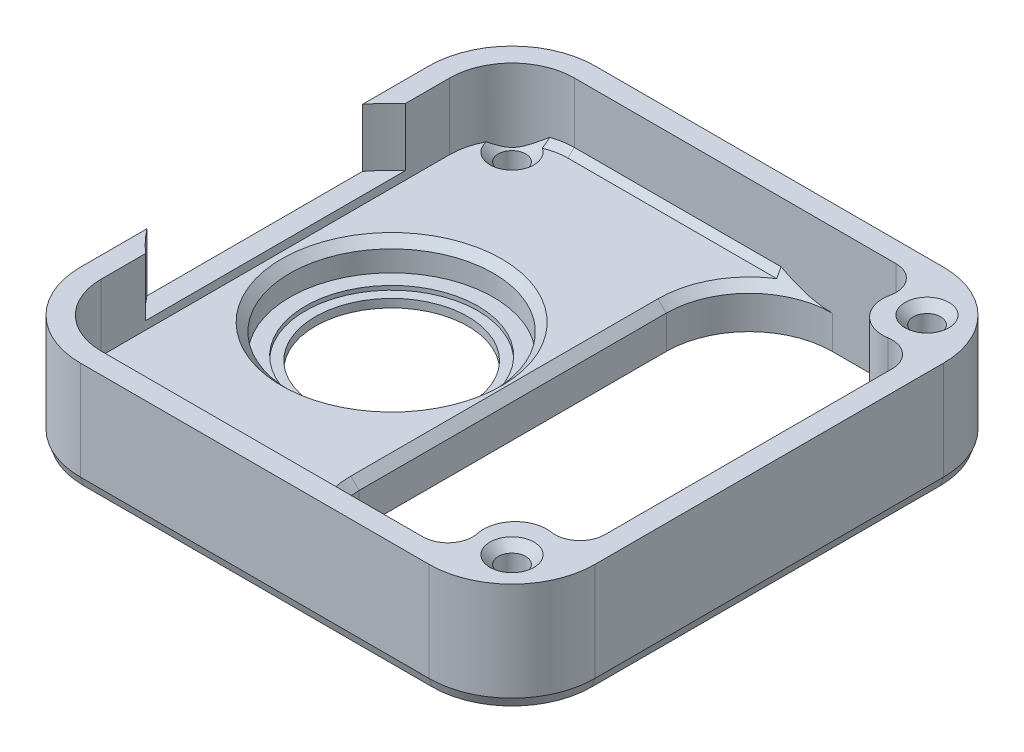
from build123d import *

# Parameters (mm, degrees)
CROQUIS1_W                 = 62
CROQUIS1_H                 = 62
SALIENTE_EXTRUIR1_DEPTH    = 13
REDONDEO1_R                = 10
REDONDEO2_R                = 10
VACIADO1_T                 = -2.5
CROQUIS2_R                 = 21
CORTAR_EXTRUIR1_DEPTH      = 7
SALIENTE_EXTRUIR2_DEPTH    = 5
CROQUIS6_R                 = 12.25
CORTAR_EXTRUIR4_DEPTH      = 4
REDONDEO3_R                = 10
CROQUIS8_R                 = 3.813498279
SALIENTE_EXTRUIR3_DEPTH    = 13
REDONDEO4_R                = 3
CORTAR_EXTRUIR7_DEPTH      = 71.52659088
CORTAR_EXTRUIR7_DEPTH_BACK = 71.52659088
CROQUIS9_R                 = 1.65
CHAFL_N1_SIZE              = 1
CHAFL_N2_SIZE              = 1
CHAFL_N3_SIZE              = 1
CHAFL_N4_SIZE              = 0.4
CHAFL_N4_SIZE2             = 1.098990968
CHAFL_N5_SIZE              = 1
CROQUIS10_R                = 14.000593708
CROQUIS10_R_2              = 10.396987038
SALIENTE_EXTRUIR4_DEPTH    = 0.5
CROQUIS11_R                = 9.192870702
CORTAR_EXTRUIR8_DEPTH      = 71.349129497
CHAFL_N6_SIZE              = 0.75


with BuildPart() as part:
    # Croquis1 → Saliente-Extruir1 (new body)
    with BuildSketch(Plane(origin=(0, 0, 0), x_dir=(1, 0, 0), z_dir=(0, 1, 0))):
        with Locations((31, 0)):
            Rectangle(CROQUIS1_W, CROQUIS1_H)
    extrude(amount=SALIENTE_EXTRUIR1_DEPTH)

    # Redondeo1
    redondeo1_edges = [part.edges().sort_by_distance(p)[0] for p in [
        (62, 6.5, -31),
        (62, 6.5, 31),
    ]]
    fillet(redondeo1_edges, radius=REDONDEO1_R)

    # Redondeo2
    redondeo2_edges = [part.edges().sort_by_distance(p)[0] for p in [
        (0, 6.5, -31),
        (0, 6.5, 31),
    ]]
    fillet(redondeo2_edges, radius=REDONDEO2_R)

    # Vaciado1
    vaciado1_openings = [part.faces().sort_by_distance(p)[0] for p in [
        (31, 13, 0),
        (31, 0, 0),
    ]]
    offset(amount=VACIADO1_T, openings=vaciado1_openings, kind=Kind.INTERSECTION)

    # Croquis2 → Cortar-Extruir1 (cut)
    with BuildSketch(Plane(origin=(0, 13, 0), x_dir=(1, 0, 0), z_dir=(0, 1, 0))):
        with Locations((16.5, 0)):
            Circle(CROQUIS2_R)
    extrude(amount=-CORTAR_EXTRUIR1_DEPTH, mode=Mode.SUBTRACT)

    # Croquis4 → Saliente-Extruir2 (add)
    with BuildSketch(Plane.XZ):
        with BuildLine():
            Line((7.085748882, 29.157404391), (31.085748882, 29.157404391))
            Line((31.085748882, 29.157404391), (31.085748882, -29.960159471))
            Line((31.085748882, -29.960159471), (7.085748882, -29.960159471))
            ThreePointArc((7.085748882, -29.960159471), (3.550214976, -28.495693377), (2.085748882, -24.960159471))
            Line((2.085748882, -24.960159471), (2.085748882, 24.157404391))
            ThreePointArc((2.085748882, 24.157404391), (3.550214976, 27.692938297), (7.085748882, 29.157404391))
        make_face()
    extrude(amount=-SALIENTE_EXTRUIR2_DEPTH)

    # Croquis6 → Cortar-Extruir4 (cut)
    with BuildSketch(Plane(origin=(0, 5, 0), x_dir=(1, 0, 0), z_dir=(0, 1, 0))):
        with Locations(Location((16.5, 0, 0), (0, 0, 270))):
            Circle(CROQUIS6_R)
    extrude(amount=-CORTAR_EXTRUIR4_DEPTH, mode=Mode.SUBTRACT)

    # Redondeo3
    redondeo3_edges = [part.edges().sort_by_distance(p)[0] for p in [
        (31.085748882, 2.5, -28.5),
        (31.085748882, 2.5, 28.5),
    ]]
    fillet(redondeo3_edges, radius=REDONDEO3_R)

    # Croquis8 → Saliente-Extruir3 (add)
    with BuildSketch(Plane(origin=(0, 13, 0), x_dir=(1, 0, 0), z_dir=(0, 1, 0))):
        with Locations((55.43014903, 24.042715564)):
            Circle(CROQUIS8_R)
        with Locations((55.43014903, -24.042715564)):
            Circle(CROQUIS8_R)
    extrude(amount=-SALIENTE_EXTRUIR3_DEPTH)

    # Redondeo4
    redondeo4_edges = [part.edges().sort_by_distance(p)[0] for p in [
        (55.076843568, 6.5, 27.839812399),
        (59.157992619, 6.5, 23.239004614),
        (59.157992619, 6.5, -23.239004614),
        (55.076843568, 6.5, -27.839812399),
    ]]
    fillet(redondeo4_edges, radius=REDONDEO4_R)

    # Croquis9 → Cortar-Extruir7 (cut, two sides: drawn at the far end of the back side and taken through both)
    with BuildSketch(Plane(origin=(0, 13, 0), x_dir=(1, 0, 0), z_dir=(0, 1, 0)).offset(-CORTAR_EXTRUIR7_DEPTH_BACK)):
        with Locations(Location((6, 25, 0), (0, 0, 270))):
            Circle(CROQUIS9_R)
        with Locations(Location((56, -25, 0), (0, 0, 270))):
            Circle(CROQUIS9_R)
        with Locations(Location((56, 25, 0), (0, 0, 270))):
            Circle(CROQUIS9_R)
        with Locations(Location((6, -25, 0), (0, 0, 270))):
            Circle(CROQUIS9_R)
    extrude(amount=CORTAR_EXTRUIR7_DEPTH + CORTAR_EXTRUIR7_DEPTH_BACK, mode=Mode.SUBTRACT)

    # Chaflán1
    # the kernel refuses this chamfer: 1 mm, written as the material it takes off along each edge
    with BuildSketch(Plane(origin=(6, 5, 25), x_dir=(0, 0, 1), z_dir=(-1, 0, 0))) as chafl_n1_piece_1_section:
        Polygon((1.65, -CHAFL_N1_SIZE), (1.65 + CHAFL_N1_SIZE, 0), (1.65, 0), align=None)
    chafl_n1_piece_1 = revolve(axis=Axis((6, 5, 25), (0, 1, 0)), mode=Mode.PRIVATE)
    chafl_n1_piece_1 = chafl_n1_piece_1 & Plane(origin=(10, 4.51284456, 21), x_dir=(-1, 0, 0), z_dir=(0, 1, 0)) * Cylinder(7.5, 11, mode=Mode.PRIVATE)
    add(chafl_n1_piece_1, mode=Mode.SUBTRACT)
    with BuildSketch(Plane(origin=(56, 13, -25), x_dir=(0, 0, 1), z_dir=(-1, 0, 0))) as chafl_n1_piece_2:
        Polygon((1.65, -CHAFL_N1_SIZE), (1.65 + CHAFL_N1_SIZE, 0), (1.65, 0), align=None)
    revolve(axis=Axis((56, 13, -25), (0, 1, 0)), mode=Mode.SUBTRACT)
    with BuildSketch(Plane(origin=(56, 13, 25), x_dir=(0, 0, 1), z_dir=(-1, 0, 0))) as chafl_n1_piece_3:
        Polygon((1.65, -CHAFL_N1_SIZE), (1.65 + CHAFL_N1_SIZE, 0), (1.65, 0), align=None)
    revolve(axis=Axis((56, 13, 25), (0, 1, 0)), mode=Mode.SUBTRACT)
    with BuildSketch(Plane(origin=(6, 5, -25), x_dir=(0, 0, 1), z_dir=(-1, 0, 0))) as chafl_n1_piece_4_section:
        Polygon((1.65, -CHAFL_N1_SIZE), (1.65 + CHAFL_N1_SIZE, 0), (1.65, 0), align=None)
    chafl_n1_piece_4 = revolve(axis=Axis((6, 5, -25), (0, 1, 0)), mode=Mode.PRIVATE)
    chafl_n1_piece_4 = chafl_n1_piece_4 & Plane(origin=(10, 4.512844583, -21), x_dir=(0, 0, -1), z_dir=(0, 1, 0)) * Cylinder(7.5, 11, mode=Mode.PRIVATE)
    add(chafl_n1_piece_4, mode=Mode.SUBTRACT)

    # Chaflán2
    chafl_n2_edges = [part.edges().sort_by_distance(p)[0] for p in [
        (16.5, 5, -12.25),
    ]]
    chamfer(chafl_n2_edges, length=CHAFL_N2_SIZE)

    # Chaflán3
    chafl_n3_edges = [part.edges().sort_by_distance(p)[0] for p in [
        (31.085748882, 5, 0),
        (34.01468107, 5, 25.571067812),
        (34.01468107, 5, -25.571067812),
    ]]
    chamfer(chafl_n3_edges, length=CHAFL_N3_SIZE)

    # Chaflán4
    chafl_n4_edges = [part.edges().sort_by_distance(p)[0] for p in [
        (31, 0, -31),
        (62, 0, 0),
        (59.071067812, 0, 28.071067812),
        (59.071067812, 0, -28.071067812),
        (31, 0, 31),
        (0, 0, 0),
        (2.928932188, 0, -28.071067812),
        (2.928932188, 0, 28.071067812),
    ]]
    chafl_n4_side = [part.faces().sort_by_distance(p)[0] for p in [
        (22.290109536, 0, 0),
    ]]
    chamfer(chafl_n4_edges, length=CHAFL_N4_SIZE, length2=CHAFL_N4_SIZE2, reference=chafl_n4_side[0])

    # Chaflán5
    chafl_n5_edges = [part.edges().sort_by_distance(p)[0] for p in [
        (6, 0, 23.35),
        (56, 0, -26.65),
        (56, 0, 23.35),
        (6, 0, -26.65),
    ]]
    chamfer(chafl_n5_edges, length=CHAFL_N5_SIZE)

    # Croquis10 → Saliente-Extruir4 (add)
    with BuildSketch(Plane(origin=(0, 1, 0), x_dir=(1, 0, 0), z_dir=(0, 1, 0))):
        with Locations((16.5, 0)):
            Circle(CROQUIS10_R)
        with Locations(Location((16.5, 0, 0), (0, 0, 270))):
            Circle(CROQUIS10_R_2, mode=Mode.SUBTRACT)
    extrude(amount=SALIENTE_EXTRUIR4_DEPTH)

    # Croquis11 → Cortar-Extruir8 (cut, through all)
    with BuildSketch(Plane(origin=(0, 1, 0), x_dir=(1, 0, 0), z_dir=(0, 1, 0))):
        with Locations(Location((16.5, 0, 0), (0, 0, 270))):
            Circle(CROQUIS11_R)
    extrude(amount=-CORTAR_EXTRUIR8_DEPTH, mode=Mode.SUBTRACT)

    # Chaflán6
    chafl_n6_edges = [part.edges().sort_by_distance(p)[0] for p in [
        (8.173443839, 5, 28.274179857),
        (23.251586594, 5, 28.5),
        (8.173443839, 5, -28.274179857),
        (23.251586594, 5, -28.5),
    ]]
    chamfer(chafl_n6_edges, length=CHAFL_N6_SIZE)


solid = part.part
